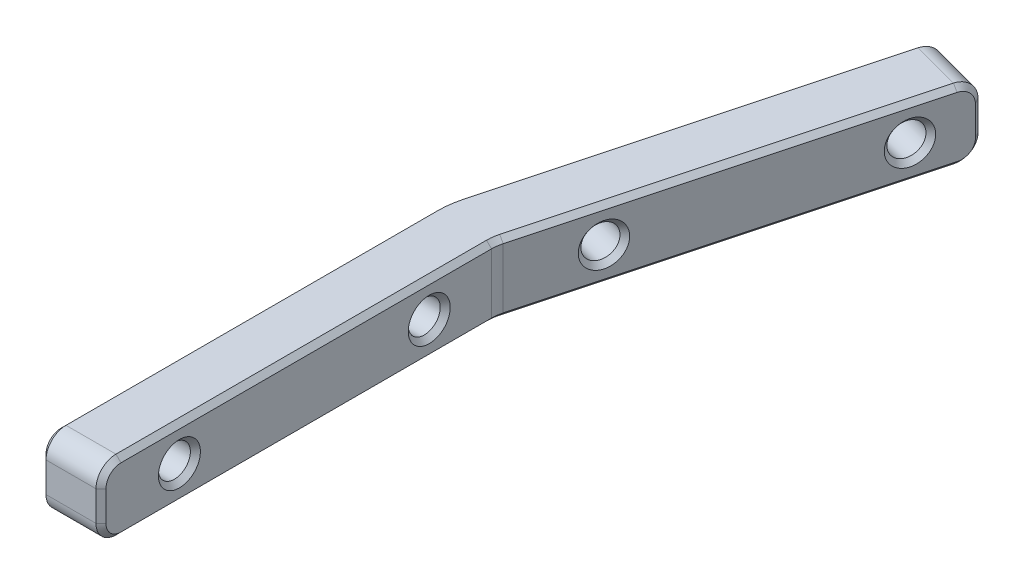
from build123d import *

# Parameters (mm, degrees)
BOSS_EXTRUDE1_DEPTH = 8.89
SKETCH2_R           = 2.032
CUT_EXTRUDE1_DEPTH  = 54.189709887
CUT_EXTRUDE2_REACH  = 55.452
SKETCH3_R           = 2.032
FILLET1_R           = 2.54
FILLET2_R           = 5.08
FILLET3_R           = 11.43
CHAMFER1_SIZE       = 0.635


with BuildPart() as part:
    # Sketch1 → Boss-Extrude1 (new body)
    with BuildSketch(Plane(origin=(0, 0, 0), x_dir=(1, 0, 0), z_dir=(0, 1, 0))):
        Polygon((3.81, -0.501596016), (3.81, -50.8), (-3.81, -50.8), (-3.81, 0.501596016), (9.467830093, 50.055132537), (16.828184889, 48.082931414), align=None)
    extrude(amount=BOSS_EXTRUDE1_DEPTH)

    # Sketch2 → Cut-Extrude1 (cut, through all)
    with BuildSketch(Plane(origin=(3.81, 0, 0), x_dir=(0, 0, -1), z_dir=(1, 0, 0))):
        with Locations((-40.833442343, 4.445)):
            Circle(SKETCH2_R)
        with Locations((-9.083442343, 4.445)):
            Circle(SKETCH2_R)
    extrude(amount=-CUT_EXTRUDE1_DEPTH, mode=Mode.SUBTRACT)

    # Sketch3 → Cut-Extrude2 (cut, up to next)
    with BuildSketch(Plane(origin=(3.680177398, 0, 0.986100562), x_dir=(0.25881904510251424, 0, -0.9659258262890701), z_dir=(0.9659258262890701, 0, 0.25881904510251424)), mode=Mode.PRIVATE) as cut_extrude2_sk1:
        with Locations((43.373442343, 4.445)):
            Circle(SKETCH3_R)
    cut_extrude2_tool1 = extrude(cut_extrude2_sk1.sketch, amount=-CUT_EXTRUDE2_REACH, mode=Mode.PRIVATE) & part.part
    # Sketch3 → Cut-Extrude2 (cut, up to next)
    with BuildSketch(Plane(origin=(3.680177398, 0, 0.986100562), x_dir=(0.25881904510251424, 0, -0.9659258262890701), z_dir=(0.9659258262890701, 0, 0.25881904510251424)), mode=Mode.PRIVATE) as cut_extrude2_sk2:
        with Locations((11.623442343, 4.445)):
            Circle(SKETCH3_R)
    cut_extrude2_tool2 = extrude(cut_extrude2_sk2.sketch, amount=-CUT_EXTRUDE2_REACH, mode=Mode.PRIVATE) & part.part
    add(cut_extrude2_tool1.solids().sort_by_distance((14.90605, 4.445, -40.909428))[0], mode=Mode.SUBTRACT)
    add(cut_extrude2_tool2.solids().sort_by_distance((6.688546, 4.445, -10.241283))[0], mode=Mode.SUBTRACT)

    # Fillet1
    fillet1_edges = [part.edges().sort_by_distance(p)[0] for p in [
        (13.148007491, 0, -49.069031975),
        (13.148007491, 8.89, -49.069031975),
        (0, 0, 50.8),
        (0, 8.89, 50.8),
    ]]
    fillet(fillet1_edges, radius=FILLET1_R)

    # Fillet2
    fillet2_edges = [part.edges().sort_by_distance(p)[0] for p in [
        (3.81, 4.445, 0.501596016),
    ]]
    fillet(fillet2_edges, radius=FILLET2_R)

    # Fillet3
    fillet3_edges = [part.edges().sort_by_distance(p)[0] for p in [
        (-3.81, 4.445, -0.501596016),
    ]]
    fillet(fillet3_edges, radius=FILLET3_R)

    # Chamfer1
    chamfer1_edges = [part.edges().sort_by_distance(p)[0] for p in [
        (7.019775232, 4.445, -40.918867417),
        (-1.19772945, 4.445, -10.250722432),
        (-3.81, 4.445, 42.865442343),
        (-3.81, 4.445, 11.115442343),
        (-3.712214766, 8.89, -0.488722345),
        (2.694948762, 8.89, -24.778395296),
        (9.275281981, 8.146051224, -49.336533201),
        (9.467830093, 4.445, -50.055132537),
        (9.275281981, 0.743948776, -49.336533201),
        (-3.81, 8.89, 24.631596016),
        (-3.81, 8.146051224, 50.056051224),
        (-3.81, 4.445, 50.8),
        (-3.81, 0.743948776, 50.056051224),
        (2.694948762, 0, -24.778395296),
        (-3.712214766, 0, -0.488722345),
        (-3.81, 0, 24.631596016),
        (3.81, 4.445, 42.865442343),
        (3.81, 4.445, 11.115442343),
        (3.853460104, 8.89, 0.507317647),
        (3.81, 8.89, 24.715195352),
        (3.81, 8.146051224, 50.056051224),
        (3.81, 4.445, 50.8),
        (3.81, 0.743948776, 50.056051224),
        (3.81, 0, 24.715195352),
        (3.853460104, 0, 0.507317647),
        (10.076940659, 0, -22.88694493),
        (16.635636778, 0.743948776, -47.364332078),
        (16.828184889, 4.445, -48.082931414),
        (16.635636778, 8.146051224, -47.364332078),
        (10.076940659, 8.89, -22.88694493),
        (14.380130029, 4.445, -38.946666293),
        (6.162625347, 4.445, -8.278521309),
    ]]
    chamfer(chamfer1_edges, length=CHAMFER1_SIZE)


solid = part.part
